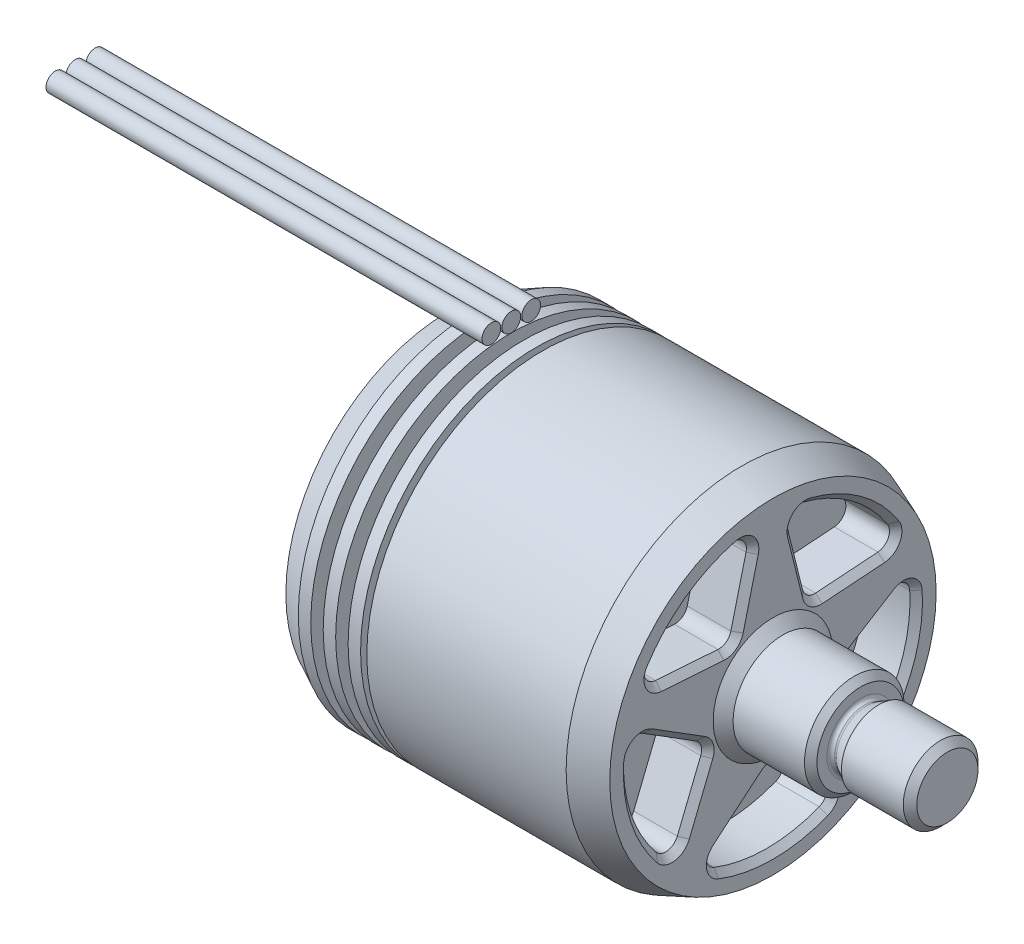
from build123d import *

# Parameters (mm, degrees)
SKETCH_1_R                       = 14.1
EXTRUDE_1_DEPTH                  = 26
SKETCH_2_R                       = 4
EXTRUDE_2_DEPTH                  = 14
CHAMFER1_SIZE                    = 0.8
CHAMFER4_SIZE                    = 0.5
HOLE_WIZARD_M3_1_D               = 2.5
HOLE_WIZARD_M3_1_DEPTH           = 8.5
HOLE_WIZARD_M3_1_TIP             = 0.751075774
CHAMFER_1_SIZE                   = 2.5
CHAMFER_1_SIZE2                  = 1
CUT_EXTRUDE_1_DEPTH              = 4
FILLET_1_R                       = 1
PATTERN_CIRCULAR_1_COUNT         = 5
FILLET_1_OF_PATTERN_CIRCULAR_1_R = 1
CHAMFER2_SIZE                    = 0.5
SKETCH2_W                        = 0.5
SKETCH2_H                        = 4.1
SKETCH2_W_2                      = 1
SKETCH2_H_2                      = 2.1
CHAMFER3_SIZE                    = 1
CHAMFER3_SIZE2                   = 2
EXTRUDE_3_DEPTH                  = 5
EXTRUDE_3_DEPTH_BACK             = 30
SKETCH_9_R                       = 0.75
EXTRUDE_3_2_DEPTH                = 5
EXTRUDE_3_2_DEPTH_BACK           = 30
EXTRUDE_3_3_DEPTH                = 5
EXTRUDE_3_3_DEPTH_BACK           = 30


# Read off the part's stored shape, not the designer's step: M6 Machine Threads Stud1
with BuildPart() as part:
    # 草图1 → 凸台-拉伸1 (new body)
    with BuildSketch(Plane(origin=(0, 0, 0), x_dir=(0, 0, -1), z_dir=(1, 0, 0))):
        with Locations(Location((0, 0, 0), (0, 0, 180))):
            Circle(SKETCH_1_R)
    extrude(amount=EXTRUDE_1_DEPTH)

    # 草图2 → 凸台-拉伸2 (add)
    with BuildSketch(Plane(origin=(26, 0, 0), x_dir=(0, 0, -1), z_dir=(1, 0, 0))):
        Circle(SKETCH_2_R)
    extrude(amount=EXTRUDE_2_DEPTH)

    # M6 Machine Threads Stud1 outline → M6 Machine Threads Stud1 (revolve, cut)
    with BuildSketch(Plane.YX):
        with BuildLine():
            Line((4, 40), (2.4585, 40))
            Line((2.4585, 40), (3, 39.4585))
            Line((3, 39.4585), (3, 34.5))
            Line((3, 34.5), (2.440192379, 33.530384758))
            ThreePointArc((2.440192379, 33.530384758), (2.410222252, 33.458030472), (2.4, 33.380384758))
            Line((2.4, 33.380384758), (2.4, 33.330384758))
            ThreePointArc((2.4, 33.330384758), (2.487867965, 33.118252723), (2.7, 33.030384758))
            Line((2.7, 33.030384758), (4, 33.030384758))
            Line((4, 33.030384758), (4, 40))
        make_face()
    revolve(axis=Axis((0, 0, 0), (1, 0, 0)), mode=Mode.SUBTRACT)

    # Chamfer1
    chamfer1_edges = [part.edges().sort_by_distance(p)[0] for p in [
        (26, 0, 4),
    ]]
    chamfer(chamfer1_edges, length=CHAMFER1_SIZE)

    # Chamfer4
    chamfer4_edges = [part.edges().sort_by_distance(p)[0] for p in [
        (33.030384758, 0, 4),
    ]]
    chamfer(chamfer4_edges, length=CHAMFER4_SIZE)

    # M3 螺纹孔1
    with Locations(Plane.ZY):
        with Locations((8, 0), (0, 9.5), (0, -9.5), (-8, 0)):
            Hole(HOLE_WIZARD_M3_1_D / 2, depth=HOLE_WIZARD_M3_1_DEPTH)
            with Locations((0, 0, -(HOLE_WIZARD_M3_1_DEPTH + HOLE_WIZARD_M3_1_TIP / 2))):  # 118° drill point
                Cone(0, HOLE_WIZARD_M3_1_D / 2, HOLE_WIZARD_M3_1_TIP, mode=Mode.SUBTRACT)

    # 倒角1
    chamfer_1_edges = [part.edges().sort_by_distance(p)[0] for p in [
        (26, 0, -14.1),
    ]]
    chamfer_1_side = [part.faces().sort_by_distance(p)[0] for p in [
        (13, 0, -14.1),
    ]]
    chamfer(chamfer_1_edges, length=CHAMFER_1_SIZE, length2=CHAMFER_1_SIZE2, reference=chamfer_1_side[0])

    # 草图8 → 切除-拉伸1 (cut)
    with BuildSketch(Plane(origin=(26, 0, 0), x_dir=(0, 0, -1), z_dir=(1, 0, 0))):
        with BuildLine():
            Line((0, -5.238373922), (-5.676389324, -10.00143011))
            ThreePointArc((-5.676389324, -10.00143011), (0, -11.5), (5.676389324, -10.00143011))
            Line((5.676389324, -10.00143011), (0, -5.238373922))
        make_face()
    cut_extrude_1 = extrude(amount=-CUT_EXTRUDE_1_DEPTH, mode=Mode.SUBTRACT)

    # 圆角1
    fillet_1_edges = [part.edges().sort_by_distance(p)[0] for p in [
        (24, -10.00143011, 5.676389324),
        (24, -5.238373922, 0),
        (24, -10.00143011, -5.676389324),
    ]]
    fillet(fillet_1_edges, radius=FILLET_1_R)

    # 阵列(圆周)1: 切除-拉伸1 ×5 about axis
    pattern_circular_1_axis = Axis((0, 0, 0), (1, 0, 0))
    for i in range(1, PATTERN_CIRCULAR_1_COUNT):
        add(cut_extrude_1.rotate(pattern_circular_1_axis, i * 360 / PATTERN_CIRCULAR_1_COUNT), mode=Mode.SUBTRACT)

    # 圆角1 of 阵列(圆周)1
    fillet_1_of_pattern_circular_1_edges = [part.edges().sort_by_distance(p)[0] for p in [
        (24, -8.489178927, -7.757824511),
        (24, -1.618746565, -4.981989654),
        (24, 2.307955183, -11.266026046),
        (24, 4.754828997, -10.47098855),
        (24, 4.237933526, -3.079038938),
        (24, 11.427824858, -1.286397691),
        (24, 11.427824858, 1.286397691),
        (24, 4.237933526, 3.079038938),
        (24, 4.754828997, 10.47098855),
        (24, 2.307955183, 11.266026046),
        (24, -1.618746565, 4.981989654),
        (24, -8.489178927, 7.757824511),
    ]]
    fillet(fillet_1_of_pattern_circular_1_edges, radius=FILLET_1_OF_PATTERN_CIRCULAR_1_R)

    # Chamfer2
    chamfer2_edges = [part.edges().sort_by_distance(p)[0] for p in [
        (26, 0.155972278, 7.822133498),
        (26, -4.723918935, 6.236560727),
        (26, -3.553695435, 10.937149937),
        (26, -1.713122608, 5.272449246),
        (26, 1.526939092, 10.938601831),
        (26, -7.664868512, 7.952002496),
        (26, 7.487489119, 2.268833731),
        (26, 4.471550488, 6.419917137),
        (26, 9.303695435, 6.759530401),
        (26, 4.485013213, 3.258552838),
        (26, 10.875078679, 1.928008487),
        (26, 5.194229162, 9.747027055),
        (26, 4.471550488, -6.419917137),
        (26, 7.487489119, -2.268833731),
        (26, 9.303695435, -6.759530401),
        (26, 4.485013213, -3.258552838),
        (26, 5.194229162, -9.747027055),
        (26, 10.875078679, -1.928008487),
        (26, -4.723918935, -6.236560727),
        (26, 0.155972278, -7.822133498),
        (26, -3.553695435, -10.937149937),
        (26, -1.713122608, -5.272449246),
        (26, -7.664868512, -7.952002496),
        (26, 1.526939092, -10.938601831),
        (26, -7.39109295, 2.565510635),
        (26, -7.39109295, -2.565510635),
        (26, -11.5, 0),
        (26, -5.543781212, 0),
        (26, -9.931378421, 4.832419234),
        (26, -9.931378421, -4.832419234),
    ]]
    chamfer(chamfer2_edges, length=CHAMFER2_SIZE)

    # Sketch2 → Cut-Revolve1 (revolve, cut)
    with BuildSketch(Plane.XY, mode=Mode.PRIVATE) as cut_revolve1_sk:
        with Locations((7.25, 12.05)):
            Rectangle(SKETCH2_W, SKETCH2_H)
        with Locations((3.5, 13.05)):
            Rectangle(SKETCH2_W_2, SKETCH2_H_2)
        with Locations((5.5, 13.05)):
            Rectangle(SKETCH2_W_2, SKETCH2_H_2)
    revolve(cut_revolve1_sk.sketch.rotate(Axis((0, 0, 0), (1, 0, 0)), 90), axis=Axis((0, 0, 0), (1, 0, 0)), mode=Mode.SUBTRACT)

    # Chamfer3
    chamfer3_edges = [part.edges().sort_by_distance(p)[0] for p in [
        (0, 0, -14.1),
    ]]
    chamfer3_side = [part.faces().sort_by_distance(p)[0] for p in [
        (0, 0, 0),
    ]]
    chamfer(chamfer3_edges, length=CHAMFER3_SIZE, length2=CHAMFER3_SIZE2, reference=chamfer3_side[0])


with BuildPart() as body_2:
    # 草图9 → 凸台-拉伸3 (new, two sides: drawn at the far end of the back side and taken through both)
    with BuildSketch(Plane(origin=(0, 0, 0), x_dir=(0, 0, -1), z_dir=(1, 0, 0)).offset(-EXTRUDE_3_DEPTH_BACK)):
        with Locations((0, 14.85)):
            Circle(SKETCH_9_R)
    extrude(amount=EXTRUDE_3_DEPTH + EXTRUDE_3_DEPTH_BACK)


with BuildPart() as body_3:
    # 草图9 → Extrude 3 2 (new, two sides: drawn at the far end of the back side and taken through both)
    with BuildSketch(Plane(origin=(0, 0, 0), x_dir=(0, 0, -1), z_dir=(1, 0, 0)).offset(-EXTRUDE_3_2_DEPTH_BACK)):
        with Locations((-1.6, 14.85)):
            Circle(SKETCH_9_R)
    extrude(amount=EXTRUDE_3_2_DEPTH + EXTRUDE_3_2_DEPTH_BACK)


with BuildPart() as body_4:
    # 草图9 → Extrude 3 3 (new, two sides: drawn at the far end of the back side and taken through both)
    with BuildSketch(Plane(origin=(0, 0, 0), x_dir=(0, 0, -1), z_dir=(1, 0, 0)).offset(-EXTRUDE_3_3_DEPTH_BACK)):
        with Locations(Location((1.6, 14.85, 0), (0, 0, 180))):
            Circle(SKETCH_9_R)
    extrude(amount=EXTRUDE_3_3_DEPTH + EXTRUDE_3_3_DEPTH_BACK)


solid = Compound([part.part, body_2.part, body_3.part, body_4.part])
